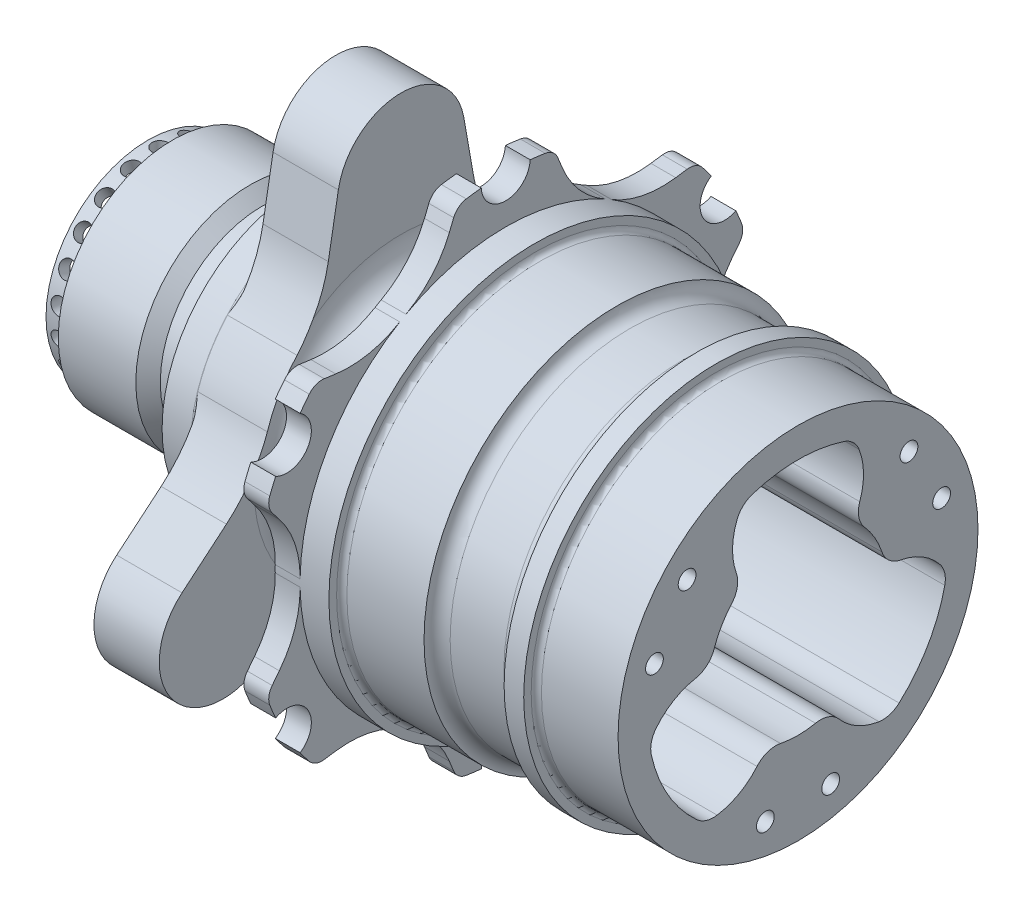
from build123d import *

# Parameters (mm, degrees)
SKETCH19_R          = 5.975
SKETCH19_R_2        = 5.97535
CUT_EXTRUDE8_DEPTH  = 9.525
CUT_EXTRUDE13_START = -645.02629754
CUT_EXTRUDE13_DEPTH = 0.72480447
CUT_EXTRUDE15_START = -644.30149307
CUT_EXTRUDE15_DEPTH = 12.803168803
CUT_EXTRUDE4_DEPTH  = 5.08
CIRPATTERN2_COUNT   = 22
SKETCH24_R          = 1.7272
HOLES_DEPTH         = 19.05
TRI_POD_DEPTH       = 56.896
FILLET16_R          = 4.7625
FILLET17_R          = 4.7625
FILLET10_R          = 1
FILLET15_R          = 2.54
CUT_EXTRUDE5_START  = -616.07849307
CUT_EXTRUDE5_DEPTH  = 4.826
CUT_EXTRUDE7_START  = -4.826
CUT_EXTRUDE7_DEPTH  = 4.826
FILLET9_R           = 19.05
SKETCH44_R          = 53.602630788
SKETCH44_R_2        = 49.149
CUT_EXTRUDE16_DEPTH = 12.7
FILLET18_R          = 3.175


with BuildPart() as part:
    # Sketch9 → main (revolve)
    with BuildSketch(Plane.XY.offset(-765.175), mode=Mode.PRIVATE) as main_sk:
        with BuildLine():
            Line((-605.64049307, 240.7), (-589.64049307, 240.7))
            Line((-589.64049307, 240.7), (-589.64049307, 238.16))
            Line((-589.64049307, 238.16), (-574.11649307, 238.16))
            Line((-574.11649307, 238.16), (-574.11649307, 240.65))
            Line((-574.11649307, 240.65), (-570.30649307, 240.65))
            Line((-570.30649307, 240.65), (-570.30649307, 238.2))
            Line((-570.30649307, 238.2), (-554.40649307, 238.2))
            Line((-554.40649307, 238.2), (-554.40649307, 203.2))
            Line((-554.40649307, 203.2), (-616.07849307, 203.2))
            Line((-616.07849307, 203.2), (-616.07849307, 218.1225))
            Line((-616.07849307, 218.1225), (-616.07849307, 220.6625))
            Line((-616.07849307, 220.6625), (-618.61849307, 220.6625))
            Line((-618.61849307, 220.6625), (-680.81399307, 220.6625))
            Line((-680.81399307, 220.6625), (-680.81399307, 223.04375))
            Line((-680.81399307, 223.04375), (-676.05149307, 223.04375))
            Line((-676.05149307, 223.04375), (-676.05149307, 225.425))
            Line((-676.05149307, 225.425), (-660.97024307, 225.425))
            Line((-660.97024307, 225.425), (-658.58899307, 223.04375))
            Line((-658.58899307, 223.04375), (-655.41399307, 223.04375))
            ThreePointArc((-655.41399307, 223.04375), (-652.046397025, 224.438653955), (-650.65149307, 227.80625))
            Line((-650.65149307, 227.80625), (-650.65149307, 230.632))
            Line((-650.65149307, 230.632), (-645.09524307, 230.632))
            ThreePointArc((-645.09524307, 230.632), (-644.533977063, 230.864483992), (-644.30149307, 231.42575))
            Line((-644.30149307, 231.42575), (-644.30149307, 255.5875))
            Line((-644.30149307, 255.5875), (-631.60149307, 255.5875))
            Line((-631.60149307, 255.5875), (-631.60149307, 231.775))
            ThreePointArc((-631.60149307, 231.775), (-629.741621131, 227.284871939), (-625.25149307, 225.425))
            Line((-625.25149307, 225.425), (-622.42849307, 225.425))
            ThreePointArc((-622.42849307, 225.425), (-617.93836501, 227.284871939), (-616.07849307, 231.775))
            Line((-616.07849307, 231.775), (-616.07849307, 254))
            Line((-616.07849307, 254), (-611.25249307, 254))
            Line((-611.25249307, 254), (-611.25249307, 243.2))
            Line((-611.25249307, 243.2), (-605.64049307, 243.2))
            Line((-605.64049307, 243.2), (-605.64049307, 240.7))
        make_face()
    revolve(main_sk.sketch.rotate(Axis((-597.64049307, 203.2, -765.175), (1, 0, 0)), 90), axis=Axis((-597.64049307, 203.2, -765.175), (1, 0, 0)))

    # Sketch19 → Cut-Extrude8 (cut)
    with BuildSketch(Plane(origin=(-644.30149307, 0, 0), x_dir=(0, 0, -1), z_dir=(1, 0, 0))):
        with Locations(Location((799.816016151, 183.2, 0), (0, 0, 180))):
            Circle(SKETCH19_R)
        with Locations(Location((730.533983849, 183.2, 0), (0, 0, 180))):
            Circle(SKETCH19_R)
        with Locations(Location((765.175, 243.2, 0), (0, 0, 180))):
            Circle(SKETCH19_R_2)
    extrude(amount=CUT_EXTRUDE8_DEPTH, mode=Mode.SUBTRACT)

    # Cut-Extrude13: read off the stored shape, not the designer's step
    # Cut-Extrude13 outline → Cut-Extrude13 (cut)
    with BuildSketch(Plane.YZ.offset(CUT_EXTRUDE13_START)):
        with BuildLine():
            ThreePointArc((221.610724147, -785.515217831), (216.9175, -788.934406953), (211.609783287, -791.289263728))
            ThreePointArc((211.609783287, -791.289263728), (209.452530625, -792.093602641), (207.376972609, -793.089975603))
            Line((207.376972609, -793.089975603), (203.820901218, -795))
            Line((203.820901218, -795), (227, -795))
            Line((227, -795), (227, -781.689189752))
            Line((227, -781.689189752), (225.286591714, -782.749852191))
            ThreePointArc((225.286591714, -782.749852191), (223.385928409, -784.049151679), (221.610724147, -785.515217831))
        make_face()
        with BuildLine():
            Line((174, -795), (177.534824105, -795))
            Line((177.534824105, -795), (176.936435678, -775.515123411))
            ThreePointArc((176.936435678, -775.515123411), (176.761540966, -773.219450962), (176.379492566, -770.949045893))
            ThreePointArc((176.379492566, -770.949045893), (175.765, -765.175), (176.379492567, -759.400954102))
            ThreePointArc((176.379492567, -759.400954102), (176.761540966, -757.130549038), (176.936435678, -754.834876589))
            Line((176.936435678, -754.834876589), (177.514862343, -736))
            Line((177.514862343, -736), (174, -736))
            Line((174, -736), (174, -795))
        make_face()
        with BuildLine():
            Line((225.286591714, -747.600147809), (227, -748.660810248))
            Line((227, -748.660810248), (227, -736))
            Line((227, -736), (205.031067124, -736))
            Line((205.031067124, -736), (207.376972609, -737.260024397))
            ThreePointArc((207.376972609, -737.260024397), (209.452530625, -738.256397359), (211.609783292, -739.060736273))
            ThreePointArc((211.609783292, -739.060736273), (216.9175, -741.415593047), (221.610724147, -744.834782169))
            ThreePointArc((221.610724147, -744.834782169), (223.385928409, -746.300848321), (225.286591714, -747.600147809))
        make_face()
    extrude(amount=CUT_EXTRUDE13_DEPTH, mode=Mode.SUBTRACT)

    # Cut-Extrude15: read off the stored shape, not the designer's step
    # Cut-Extrude15 outline → Cut-Extrude15 (cut)
    with BuildSketch(Plane.YZ.offset(CUT_EXTRUDE15_START)):
        with BuildLine():
            ThreePointArc((221.610724147, -785.515217831), (216.9175, -788.934406953), (211.609783287, -791.289263728))
            ThreePointArc((211.609783287, -791.289263728), (205.219747883, -794.390430093), (199.938239322, -799.139688211))
            Line((199.938239322, -799.139688211), (192.689375539, -807.778547666))
            ThreePointArc((192.689375539, -807.778547666), (185.3510668, -812.015322192), (177.006249999, -810.54390584))
            ThreePointArc((177.006249999, -810.54390584), (229.39375, -810.543905841), (255.5875, -765.175))
            ThreePointArc((255.5875, -765.175), (252.689375539, -773.137531515), (245.351066801, -777.37430604))
            Line((245.351066801, -777.37430604), (234.245163161, -779.332576497))
            ThreePointArc((234.245163161, -779.332576497), (227.491430701, -781.531868023), (221.610724147, -785.515217831))
        make_face()
        with BuildLine():
            ThreePointArc((177.006249999, -719.80609416), (150.8125, -765.175), (177.006249999, -810.54390584))
            ThreePointArc((177.006249999, -810.54390584), (171.55955766, -804.052790676), (171.55955766, -795.579241626))
            Line((171.55955766, -795.579241626), (175.416597517, -784.982111714))
            ThreePointArc((175.416597517, -784.982111714), (176.888821416, -778.033562071), (176.379492566, -770.949045893))
            ThreePointArc((176.379492566, -770.949045893), (175.765, -765.175), (176.379492567, -759.400954102))
            ThreePointArc((176.379492567, -759.400954102), (176.888821416, -752.316437929), (175.416597517, -745.367888286))
            Line((175.416597517, -745.367888286), (171.55955766, -734.770758374))
            ThreePointArc((171.55955766, -734.770758374), (171.55955766, -726.297209324), (177.006249999, -719.80609416))
        make_face()
        with BuildLine():
            ThreePointArc((255.5875, -765.175), (229.39375, -719.806094159), (177.006249999, -719.80609416))
            ThreePointArc((177.006249999, -719.80609416), (185.3510668, -718.334677808), (192.689375539, -722.571452334))
            Line((192.689375539, -722.571452334), (199.938239322, -731.210311789))
            ThreePointArc((199.938239322, -731.210311789), (205.219747883, -735.959569907), (211.609783292, -739.060736273))
            ThreePointArc((211.609783292, -739.060736273), (216.9175, -741.415593047), (221.610724147, -744.834782169))
            ThreePointArc((221.610724147, -744.834782169), (227.491430701, -748.818131977), (234.245163161, -751.017423503))
            Line((234.245163161, -751.017423503), (245.351066801, -752.97569396))
            ThreePointArc((245.351066801, -752.97569396), (252.689375539, -757.212468485), (255.5875, -765.175))
        make_face()
    extrude(amount=CUT_EXTRUDE15_DEPTH, mode=Mode.SUBTRACT)

    # Sketch16 → Cut-Extrude4 (cut)
    with BuildSketch(Plane(origin=(0, 223.04375, 0), x_dir=(1, 0, 0), z_dir=(0, 1, 0))):
        with BuildLine():
            ThreePointArc((-676.84524307, 765.175), (-678.43274307, 766.7625), (-680.02024307, 765.175))
            Line((-680.02024307, 765.175), (-676.84524307, 765.175))
        make_face()
        with BuildLine():
            Line((-676.84524307, 765.175), (-680.02024307, 765.175))
            ThreePointArc((-680.02024307, 765.175), (-678.43274307, 763.5875), (-676.84524307, 765.175))
        make_face()
    cut_extrude4 = extrude(amount=-CUT_EXTRUDE4_DEPTH, mode=Mode.SUBTRACT)

    # CirPattern2: Cut-Extrude4 ×22 about axis
    cirpattern2_axis = Axis((-597.64049307, 203.2, -765.175), (-1, 0, 0))
    for i in range(1, CIRPATTERN2_COUNT):
        add(cut_extrude4.rotate(cirpattern2_axis, i * 360 / CIRPATTERN2_COUNT), mode=Mode.SUBTRACT)

    # Sketch24 → holes (cut)
    with BuildSketch(Plane(origin=(-554.40649307, 0, 0), x_dir=(0, 0, -1), z_dir=(1, 0, 0))):
        with Locations((793.096675913, 211.988238686)):
            Circle(SKETCH24_R)
        with Locations((786.746675913, 222.986761314)):
            Circle(SKETCH24_R)
        with Locations((743.603324087, 222.986761314)):
            Circle(SKETCH24_R)
        with Locations((737.253324087, 211.988238686)):
            Circle(SKETCH24_R)
        with Locations((758.825, 174.625)):
            Circle(SKETCH24_R)
        with Locations((771.525, 174.625)):
            Circle(SKETCH24_R)
    extrude(amount=-HOLES_DEPTH, mode=Mode.SUBTRACT)

    # Sketch26 → tri-pod (cut)
    with BuildSketch(Plane(origin=(-554.40649307, 0, 0), x_dir=(0, 0, -1), z_dir=(1, 0, 0))):
        with BuildLine():
            ThreePointArc((775.983573475, 230.336669645), (765.175, 232.41), (754.366426525, 230.336669645))
            ThreePointArc((754.366426525, 230.336669645), (752.437263193, 223.500009331), (754.469456471, 216.693263714))
            ThreePointArc((754.469456471, 216.693263714), (750.258310658, 211.812154607), (748.136719079, 205.7246408))
            ThreePointArc((748.136719079, 205.7246408), (741.225807819, 204.081198996), (736.269667976, 198.992164386))
            ThreePointArc((736.269667976, 198.992164386), (739.878397955, 188.595), (747.078241451, 180.271165969))
            ThreePointArc((747.078241451, 180.271165969), (753.963544626, 182.018791673), (758.842262608, 187.182095486))
            ThreePointArc((758.842262608, 187.182095486), (765.175, 185.975690786), (771.507737392, 187.182095486))
            ThreePointArc((771.507737392, 187.182095486), (776.386455374, 182.018791673), (783.271758549, 180.271165969))
            ThreePointArc((783.271758549, 180.271165969), (790.471602045, 188.595), (794.080332024, 198.992164386))
            ThreePointArc((794.080332024, 198.992164386), (789.124192181, 204.081198996), (782.213280921, 205.7246408))
            ThreePointArc((782.213280921, 205.7246408), (780.091689342, 211.812154607), (775.880543529, 216.693263714))
            ThreePointArc((775.880543529, 216.693263714), (777.912736807, 223.500009331), (775.983573475, 230.336669645))
        make_face()
    extrude(amount=-TRI_POD_DEPTH, mode=Mode.SUBTRACT)

    # Fillet16
    fillet16_edges = [part.edges().sort_by_distance(p)[0] for p in [
        (-582.85449307, 230.336669645, -775.983573475),
        (-582.85449307, 198.992164386, -794.080332024),
        (-582.85449307, 180.271165969, -783.271758549),
        (-582.85449307, 180.271165969, -747.078241451),
        (-582.85449307, 198.992164386, -736.269667976),
        (-582.85449307, 230.336669645, -754.366426525),
    ]]
    fillet(fillet16_edges, radius=FILLET16_R)

    # Fillet17
    fillet17_edges = [part.edges().sort_by_distance(p)[0] for p in [
        (-582.85449307, 216.693263714, -775.880543529),
        (-582.85449307, 205.7246408, -782.213280921),
        (-582.85449307, 187.182095486, -771.507737392),
        (-582.85449307, 187.182095486, -758.842262608),
        (-582.85449307, 205.7246408, -748.136719079),
        (-582.85449307, 216.693263714, -754.469456471),
    ]]
    fillet(fillet17_edges, radius=FILLET17_R)

    # Fillet10
    fillet10_edges = [part.edges().sort_by_distance(p)[0] for p in [
        (-605.64049307, 203.2, -802.675),
        (-570.30649307, 203.2, -800.175),
    ]]
    fillet(fillet10_edges, radius=FILLET10_R)

    # Fillet15
    # the kernel refuses this fillet: 2.54 mm, written as the material it adds along each edge
    with BuildSketch(Plane(origin=(-589.64049307, 203.2, -765.175), x_dir=(0, 0, 1), z_dir=(0, 1, 0))) as fillet15_piece_1:
        with BuildLine():
            CenterArc((34.96 + FILLET15_R, FILLET15_R), FILLET15_R, 180, 90)
            Line((34.96 + FILLET15_R, 0), (34.96, 0))
            Line((34.96, 0), (34.96, FILLET15_R))
        make_face()
    revolve(axis=Axis((-589.64049307, 203.2, -765.175), (1, 0, 0)))
    with BuildSketch(Plane(origin=(-574.11649307, 203.2, -765.175), x_dir=(0, 0, 1), z_dir=(0, 1, 0))) as fillet15_piece_2_section:
        with BuildLine():
            CenterArc((34.96 + FILLET15_R, -FILLET15_R), FILLET15_R, 90, 90)
            Line((34.96, -FILLET15_R), (34.96, 0))
            Line((34.96, 0), (34.96 + FILLET15_R, 0))
        make_face()
    fillet15_piece_2 = revolve(axis=Axis((-574.11649307, 203.2, -765.175), (1, 0, 0)), mode=Mode.PRIVATE)
    fillet15_piece_2 = fillet15_piece_2 & Plane(origin=(-574.11649307, 203.2, -765.175), x_dir=(0, 0, 1), z_dir=(1, 0, 0)) * Cylinder(37.45, 150, mode=Mode.PRIVATE)
    add(fillet15_piece_2)

    # Cut-Extrude5: read off the stored shape, not the designer's step
    # Cut-Extrude5 outline → Cut-Extrude5 (cut)
    with BuildSketch(Plane.YZ.offset(CUT_EXTRUDE5_START)):
        with BuildLine():
            ThreePointArc((224.569302161, -719.088202268), (225.393249999, -726.735163415), (232.427686534, -723.625242602))
            ThreePointArc((232.427686534, -723.625242602), (228.6, -721.180909488), (224.569302161, -719.088202268))
        make_face()
        with BuildLine():
            ThreePointArc((253.796988695, -769.712040334), (254, -765.175), (253.796988695, -760.637959666))
            ThreePointArc((253.796988695, -760.637959666), (247.5865, -765.175), (253.796988695, -769.712040334))
        make_face()
        with BuildLine():
            ThreePointArc((173.972313466, -723.625242602), (181.006750001, -726.735163415), (181.830697839, -719.088202268))
            ThreePointArc((181.830697839, -719.088202268), (177.8, -721.180909488), (173.972313466, -723.625242602))
        make_face()
        with BuildLine():
            ThreePointArc((224.569302161, -811.261797732), (228.6, -809.169090512), (232.427686534, -806.724757398))
            ThreePointArc((232.427686534, -806.724757398), (225.393249999, -803.614836585), (224.569302161, -811.261797732))
        make_face()
        with BuildLine():
            ThreePointArc((152.603011305, -769.712040334), (158.8135, -765.175), (152.603011305, -760.637959666))
            ThreePointArc((152.603011305, -760.637959666), (152.4, -765.175), (152.603011305, -769.712040334))
        make_face()
        with BuildLine():
            ThreePointArc((173.972313466, -806.724757398), (177.8, -809.169090512), (181.830697839, -811.261797732))
            ThreePointArc((181.830697839, -811.261797732), (181.006750001, -803.614836585), (173.972313466, -806.724757398))
        make_face()
    extrude(amount=CUT_EXTRUDE5_DEPTH, mode=Mode.SUBTRACT)

    # Sketch18 → Cut-Extrude7 (cut)
    with BuildSketch(Plane.ZY.offset(616.07849307).offset(CUT_EXTRUDE7_START)):
        with BuildLine():
            ThreePointArc((-732.261186055, 234.933251514), (-742.315, 242.794681461), (-754.150105017, 247.570824768))
            Line((-754.150105017, 247.570824768), (-753.721715315, 246.51122568))
            ThreePointArc((-753.721715315, 246.51122568), (-742.775, 241.99793809), (-733.393020635, 234.774448334))
            Line((-733.393020635, 234.774448334), (-732.261186055, 234.933251514))
        make_face()
        with BuildLine():
            Line((-756.44375, 253.244033345), (-754.150105017, 247.570824768))
            ThreePointArc((-754.150105017, 247.570824768), (-742.315, 242.794681461), (-732.261186055, 234.933251514))
            Line((-732.261186055, 234.933251514), (-726.201220815, 235.783500979))
            ThreePointArc((-726.201220815, 235.783500979), (-739.775, 247.194090512), (-756.44375, 253.244033345))
        make_face()
        with BuildLine():
            ThreePointArc((-719.455, 203.2), (-719.902512924, 209.58124705), (-721.236291072, 215.837573255))
            Line((-721.236291072, 215.837573255), (-721.939735949, 214.936777346))
            ThreePointArc((-721.939735949, 214.936777346), (-720.767906932, 209.120311247), (-720.375, 203.2))
            ThreePointArc((-720.375, 203.2), (-720.767906932, 197.279688753), (-721.939735949, 191.463222654))
            Line((-721.939735949, 191.463222654), (-721.236291072, 190.562426745))
            ThreePointArc((-721.236291072, 190.562426745), (-719.902512924, 196.81875295), (-719.455, 203.2))
        make_face()
        with BuildLine():
            Line((-717.469970815, 220.660532366), (-721.236291072, 215.837573255))
            ThreePointArc((-721.236291072, 215.837573255), (-719.902512924, 209.58124705), (-719.455, 203.2))
            ThreePointArc((-719.455, 203.2), (-719.902512924, 196.81875295), (-721.236291072, 190.562426745))
            Line((-721.236291072, 190.562426745), (-717.469970815, 185.739467634))
            ThreePointArc((-717.469970815, 185.739467634), (-714.375, 203.2), (-717.469970815, 220.660532366))
        make_face()
        with BuildLine():
            ThreePointArc((-754.150105017, 158.829175232), (-742.315, 163.605318539), (-732.261186055, 171.466748486))
            Line((-732.261186055, 171.466748486), (-733.393020635, 171.625551666))
            ThreePointArc((-733.393020635, 171.625551666), (-742.775, 164.40206191), (-753.721715315, 159.88877432))
            Line((-753.721715315, 159.88877432), (-754.150105017, 158.829175232))
        make_face()
        with BuildLine():
            Line((-726.201220815, 170.616499021), (-732.261186055, 171.466748486))
            ThreePointArc((-732.261186055, 171.466748486), (-742.315, 163.605318539), (-754.150105017, 158.829175232))
            Line((-754.150105017, 158.829175232), (-756.44375, 153.155966655))
            ThreePointArc((-756.44375, 153.155966655), (-739.775, 159.205909488), (-726.201220815, 170.616499021))
        make_face()
        with BuildLine():
            Line((-796.956979365, 171.625551666), (-798.088813945, 171.466748486))
            ThreePointArc((-798.088813945, 171.466748486), (-788.035, 163.605318539), (-776.199894983, 158.829175232))
            Line((-776.199894983, 158.829175232), (-776.628284685, 159.88877432))
            ThreePointArc((-776.628284685, 159.88877432), (-787.575, 164.40206191), (-796.956979365, 171.625551666))
        make_face()
        with BuildLine():
            ThreePointArc((-776.199894983, 158.829175232), (-788.035, 163.605318539), (-798.088813945, 171.466748486))
            Line((-798.088813945, 171.466748486), (-804.148779185, 170.616499021))
            ThreePointArc((-804.148779185, 170.616499021), (-790.575, 159.205909488), (-773.90625, 153.155966655))
            Line((-773.90625, 153.155966655), (-776.199894983, 158.829175232))
        make_face()
        with BuildLine():
            ThreePointArc((-809.113708928, 190.562426745), (-810.895, 203.2), (-809.113708928, 215.837573255))
            Line((-809.113708928, 215.837573255), (-812.880029185, 220.660532366))
            ThreePointArc((-812.880029185, 220.660532366), (-815.975, 203.2), (-812.880029185, 185.739467634))
            Line((-812.880029185, 185.739467634), (-809.113708928, 190.562426745))
        make_face()
        with BuildLine():
            Line((-808.410264051, 214.936777346), (-809.113708928, 215.837573255))
            ThreePointArc((-809.113708928, 215.837573255), (-810.895, 203.2), (-809.113708928, 190.562426745))
            Line((-809.113708928, 190.562426745), (-808.410264051, 191.463222654))
            ThreePointArc((-808.410264051, 191.463222654), (-809.975, 203.2), (-808.410264051, 214.936777346))
        make_face()
        with BuildLine():
            Line((-776.628284685, 246.51122568), (-776.199894983, 247.570824768))
            ThreePointArc((-776.199894983, 247.570824768), (-788.035, 242.794681461), (-798.088813945, 234.933251514))
            Line((-798.088813945, 234.933251514), (-796.956979365, 234.774448334))
            ThreePointArc((-796.956979365, 234.774448334), (-787.575, 241.99793809), (-776.628284685, 246.51122568))
        make_face()
        with BuildLine():
            Line((-776.199894983, 247.570824768), (-773.90625, 253.244033345))
            ThreePointArc((-773.90625, 253.244033345), (-790.575, 247.194090512), (-804.148779185, 235.783500979))
            Line((-804.148779185, 235.783500979), (-798.088813945, 234.933251514))
            ThreePointArc((-798.088813945, 234.933251514), (-788.035, 242.794681461), (-776.199894983, 247.570824768))
        make_face()
        with BuildLine():
            Line((-778.957262908, 240.750622221), (-776.628284685, 246.51122568))
            ThreePointArc((-776.628284685, 246.51122568), (-787.575, 241.99793809), (-796.956979365, 234.774448334))
            Line((-796.956979365, 234.774448334), (-790.803661317, 233.91110091))
            ThreePointArc((-790.803661317, 233.91110091), (-785.175, 237.841016151), (-778.957262908, 240.750622221))
        make_face()
        with BuildLine():
            ThreePointArc((-733.393020635, 234.774448334), (-742.775, 241.99793809), (-753.721715315, 246.51122568))
            Line((-753.721715315, 246.51122568), (-751.392737092, 240.750622221))
            ThreePointArc((-751.392737092, 240.750622221), (-745.175, 237.841016151), (-739.546338683, 233.91110091))
            Line((-739.546338683, 233.91110091), (-733.393020635, 234.774448334))
        make_face()
        with BuildLine():
            ThreePointArc((-720.375, 203.2), (-720.767906932, 209.120311247), (-721.939735949, 214.936777346))
            Line((-721.939735949, 214.936777346), (-725.764075775, 210.039521311))
            ThreePointArc((-725.764075775, 210.039521311), (-725.322541048, 206.632421231), (-725.175, 203.2))
            ThreePointArc((-725.175, 203.2), (-725.322541048, 199.767578769), (-725.764075775, 196.360478689))
            Line((-725.764075775, 196.360478689), (-721.939735949, 191.463222654))
            ThreePointArc((-721.939735949, 191.463222654), (-720.767906932, 197.279688753), (-720.375, 203.2))
        make_face()
        with BuildLine():
            Line((-733.393020635, 171.625551666), (-739.546338683, 172.48889909))
            ThreePointArc((-739.546338683, 172.48889909), (-745.175, 168.558983849), (-751.392737092, 165.649377779))
            Line((-751.392737092, 165.649377779), (-753.721715315, 159.88877432))
            ThreePointArc((-753.721715315, 159.88877432), (-742.775, 164.40206191), (-733.393020635, 171.625551666))
        make_face()
        with BuildLine():
            Line((-790.803661317, 172.48889909), (-796.956979365, 171.625551666))
            ThreePointArc((-796.956979365, 171.625551666), (-787.575, 164.40206191), (-776.628284685, 159.88877432))
            Line((-776.628284685, 159.88877432), (-778.957262908, 165.649377779))
            ThreePointArc((-778.957262908, 165.649377779), (-785.175, 168.558983849), (-790.803661317, 172.48889909))
        make_face()
        with BuildLine():
            Line((-804.585924225, 210.039521311), (-808.410264051, 214.936777346))
            ThreePointArc((-808.410264051, 214.936777346), (-809.975, 203.2), (-808.410264051, 191.463222654))
            Line((-808.410264051, 191.463222654), (-804.585924225, 196.360478689))
            ThreePointArc((-804.585924225, 196.360478689), (-805.175, 203.2), (-804.585924225, 210.039521311))
        make_face()
    extrude(amount=CUT_EXTRUDE7_DEPTH, mode=Mode.SUBTRACT)

    # Fillet9
    # the kernel refuses this fillet: 19.05 mm, written as the material it adds along each edge
    with BuildSketch(Plane(origin=(-611.25249307, 196.360478689, -804.585924225), x_dir=(0, 0.9955287839504713, -0.09445866993609303), z_dir=(-1, 0, 0)), Plane(origin=(-611.25249307, 165.649377779, -778.957262908), x_dir=(0, 0.41596078420288024, -0.909382552067789), z_dir=(-1, 0, 0)), Plane(origin=(-611.25249307, 172.48889909, -739.546338683), x_dir=(0, -0.5795679997475921, -0.8149238821316841), z_dir=(-1, 0, 0)), Plane(origin=(-611.25249307, 210.039521311, -725.764075775), x_dir=(0, -0.9955287839504733, 0.09445866993607217), z_dir=(-1, 0, 0)), Plane(origin=(-611.25249307, 240.750622221, -751.392737092), x_dir=(0, -0.4159607842028727, 0.9093825520677925), z_dir=(-1, 0, 0)), Plane(origin=(-611.25249307, 233.91110091, -790.803661317), x_dir=(0, 0.5795679997476418, 0.8149238821316489), z_dir=(-1, 0, 0))) as fillet9_piece_1:
        with BuildLine():
            CenterArc((7.642294, 18.99321269), FILLET9_R, 226.593031234, 38.981862216)
            Line((-5.448406466, 5.1535573), (0, 0))
            ThreePointArc((0, 0), (3.08623685, 0.119238446), (6.1724737, 0))
        make_face()
    extrude(amount=4.826)
    with BuildSketch(Plane(origin=(-611.25249307, 210.039521311, -804.585924225), x_dir=(0, -0.9955287839504713, -0.09445866993609303), z_dir=(-1, 0, 0)), Plane(origin=(-611.25249307, 172.48889909, -790.803661317), x_dir=(0, -0.5795679997475861, 0.8149238821316885), z_dir=(-1, 0, 0)), Plane(origin=(-611.25249307, 165.649377779, -751.392737092), x_dir=(0, 0.4159607842028809, 0.9093825520677887), z_dir=(-1, 0, 0)), Plane(origin=(-611.25249307, 196.360478689, -725.764075775), x_dir=(0, 0.9955287839504714, 0.09445866993609262), z_dir=(-1, 0, 0)), Plane(origin=(-611.25249307, 233.91110091, -739.546338683), x_dir=(0, 0.5795679997475957, -0.8149238821316817), z_dir=(-1, 0, 0)), Plane(origin=(-611.25249307, 240.750622221, -778.957262908), x_dir=(0, -0.4159607842028402, -0.9093825520678073), z_dir=(-1, 0, 0))) as fillet9_piece_2:
        with BuildLine():
            CenterArc((7.642294, -18.99321269), FILLET9_R, 94.42510655, 38.981862216)
            Line((-5.448406466, -5.1535573), (0, 0))
            ThreePointArc((0, 0), (3.08623685, -0.119238446), (6.1724737, 0))
        make_face()
    extrude(amount=4.826)

    # Sketch44 → Cut-Extrude16 (cut)
    with BuildSketch(Plane(origin=(-611.25249307, 0, 0), x_dir=(0, 0, -1), z_dir=(1, 0, 0))):
        with Locations((765.175, 203.2)):
            Circle(SKETCH44_R)
        with Locations((765.175, 203.2)):
            Circle(SKETCH44_R_2, mode=Mode.SUBTRACT)
    extrude(amount=-CUT_EXTRUDE16_DEPTH, mode=Mode.SUBTRACT)

    # Fillet18
    fillet18_edges = [part.edges().sort_by_distance(p)[0] for p in [
        (-613.66549307, 235.511480868, -802.210015932),
        (-613.66549307, 251.429005061, -774.640055299),
        (-613.66549307, 251.429005061, -755.709944701),
        (-613.66549307, 235.511480868, -728.139984068),
        (-613.66549307, 219.117524193, -718.674928768),
        (-613.66549307, 187.282475807, -718.674928768),
        (-613.66549307, 170.888519132, -728.139984068),
        (-613.66549307, 154.970994939, -755.709944701),
        (-613.66549307, 154.970994939, -774.640055299),
        (-613.66549307, 170.888519132, -802.210015932),
        (-613.66549307, 187.282475807, -811.675071232),
        (-613.66549307, 219.117524193, -811.675071232),
    ]]
    fillet(fillet18_edges, radius=FILLET18_R)


solid = part.part
